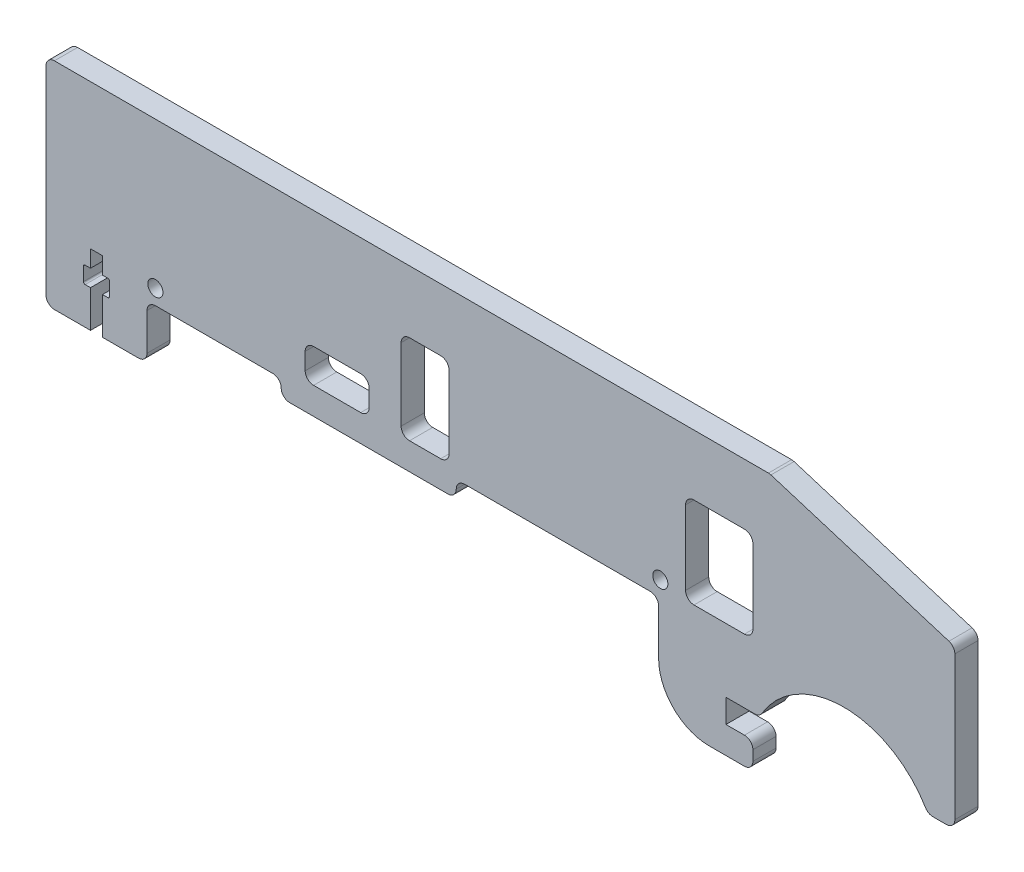
from build123d import *

# Parameters (mm, degrees)
SKETCH1_W           = 270
SKETCH1_H           = 64
BOSS_EXTRUDE1_DEPTH = 6.88
SKETCH2_W           = 20
SKETCH2_H           = 27
SKETCH2_W_2         = 152
SKETCH2_H_2         = 16
CUT_EXTRUDE1_DEPTH  = 139.911246485
SKETCH3_R           = 2.25
CUT_EXTRUDE2_DEPTH  = 139.911246485
BOSS_EXTRUDE2_DEPTH = 6.88
SKETCH5_W           = 2.085
SKETCH5_H           = 5
SKETCH5_W_2         = 3.55
SKETCH5_H_2         = 11
CUT_EXTRUDE3_DEPTH  = 144.113012686
SKETCH7_W           = 14.25
SKETCH7_H           = 26.5
SKETCH7_W_2         = 19
SKETCH7_H_2         = 10
CUT_EXTRUDE4_DEPTH  = 144.113012686
SKETCH8_W           = 52
SKETCH8_H           = 8
BOSS_EXTRUDE4_DEPTH = 6.88
CUT_EXTRUDE5_DEPTH  = 144.113012686
FILLET2_R           = 0.5
CUT_EXTRUDE6_DEPTH  = 144.113012686
FILLET1_R           = 2.5
FILLET3_R           = 15


with BuildPart() as part:
    # Sketch1 → Boss-Extrude1 (new body)
    with BuildSketch(Plane.XY):
        Rectangle(SKETCH1_W, SKETCH1_H)
    extrude(amount=BOSS_EXTRUDE1_DEPTH)

    # Sketch2 → Cut-Extrude1 (cut, through all)
    with BuildSketch(Plane.XY.offset(6.88)):
        with Locations((65, 0.5)):
            Rectangle(SKETCH2_W, SKETCH2_H)
        with Locations((-29, -24)):
            Rectangle(SKETCH2_W_2, SKETCH2_H_2)
    extrude(amount=-CUT_EXTRUDE1_DEPTH, mode=Mode.SUBTRACT)

    # Sketch3 → Cut-Extrude2 (cut, through all)
    with BuildSketch(Plane.XY.offset(6.88)):
        with Locations((-102.5, -11.5)):
            Circle(SKETCH3_R)
        with Locations((47.5, -11.5)):
            Circle(SKETCH3_R)
    extrude(amount=-CUT_EXTRUDE2_DEPTH, mode=Mode.SUBTRACT)

    # Sketch4 → Boss-Extrude2 (add)
    with BuildSketch(Plane.XY.offset(6.88)):
        Polygon((47, -32), (67, -32), (67, -39), (75, -39), (75, -47), (47, -47), align=None)
    extrude(amount=-BOSS_EXTRUDE2_DEPTH)

    # Sketch5 → Cut-Extrude3 (cut, through all)
    with BuildSketch(Plane.XY.offset(6.88)):
        with Locations((-117.1825, -18.5)):
            Rectangle(SKETCH5_W, SKETCH5_H)
        with Locations((-120, -18.5)):
            Rectangle(SKETCH5_W_2, SKETCH5_H)
        with Locations((-120, -13.5)):
            Rectangle(SKETCH5_W_2, SKETCH5_H)
        with Locations((-122.8175, -18.5)):
            Rectangle(SKETCH5_W, SKETCH5_H)
        with Locations((-120, -26.5)):
            Rectangle(SKETCH5_W_2, SKETCH5_H_2)
    extrude(amount=-CUT_EXTRUDE3_DEPTH, mode=Mode.SUBTRACT)

    # Sketch7 → Cut-Extrude4 (cut, through all)
    with BuildSketch(Plane(origin=(0, 0, 0), x_dir=(-1, 0, 0), z_dir=(0, 0, -1))):
        with Locations((22.375, 0.25)):
            Rectangle(SKETCH7_W, SKETCH7_H)
        with Locations((48.5, -8)):
            Rectangle(SKETCH7_W_2, SKETCH7_H_2)
    extrude(amount=-CUT_EXTRUDE4_DEPTH, mode=Mode.SUBTRACT)

    # Sketch8 → Boss-Extrude4 (add)
    with BuildSketch(Plane(origin=(0, 0, 0), x_dir=(-1, 0, 0), z_dir=(0, 0, -1))):
        with Locations((39.125, -17)):
            Rectangle(SKETCH8_W, SKETCH8_H)
    extrude(amount=-BOSS_EXTRUDE4_DEPTH)

    # Sketch9 → Cut-Extrude5 (cut, through all)
    with BuildSketch(Plane(origin=(0, 0, 0), x_dir=(-1, 0, 0), z_dir=(0, 0, -1))):
        with BuildLine():
            Line((-77, -32), (-127, -32))
            ThreePointArc((-127, -32), (-102, -17), (-77, -32))
        make_face()
    extrude(amount=-CUT_EXTRUDE5_DEPTH, mode=Mode.SUBTRACT)

    # Fillet2
    fillet2_edges = [part.edges().sort_by_distance(p)[0] for p in [
        (-116.14, -16, 3.44),
        (-116.14, -21, 3.44),
        (-123.86, -21, 3.44),
        (-123.86, -16, 3.44),
    ]]
    fillet(fillet2_edges, radius=FILLET2_R)

    # Sketch10 → Cut-Extrude6 (cut, through all)
    with BuildSketch(Plane.XY.offset(6.88)):
        Polygon((80, 32), (135, 15), (135, 32), align=None)
    extrude(amount=-CUT_EXTRUDE6_DEPTH, mode=Mode.SUBTRACT)

    # Fillet1
    fillet1_edges = [part.edges().sort_by_distance(p)[0] for p in [
        (55, 14, 3.44),
        (75, 14, 3.44),
        (75, -13, 3.44),
        (55, -13, 3.44),
        (-135, 32, 3.44),
        (-135, -32, 3.44),
        (47, -16, 3.44),
        (-105, -16, 3.44),
        (-105, -32, 3.44),
        (75, -47, 3.44),
        (75, -39, 3.44),
        (135, -32, 3.44),
        (-58, -13, 3.44),
        (-39, -13, 3.44),
        (-39, -3, 3.44),
        (-58, -3, 3.44),
        (-29.5, 13.5, 3.44),
        (-15.25, 13.5, 3.44),
        (-15.25, -13, 3.44),
        (-29.5, -13, 3.44),
        (-65.125, -16, 3.44),
        (-65.125, -21, 3.44),
        (-13.125, -21, 3.44),
        (-13.125, -16, 3.44),
        (127, -32, 3.44),
        (77, -32, 3.44),
        (135, 15, 3.44),
        (80, 32, 3.44),
    ]]
    fillet(fillet1_edges, radius=FILLET1_R - 0.0001)  # a hair under: the kernel refuses the full size

    # Fillet3
    fillet3_edges = [part.edges().sort_by_distance(p)[0] for p in [
        (47, -47, 3.44),
    ]]
    fillet(fillet3_edges, radius=FILLET3_R)


solid = part.part
